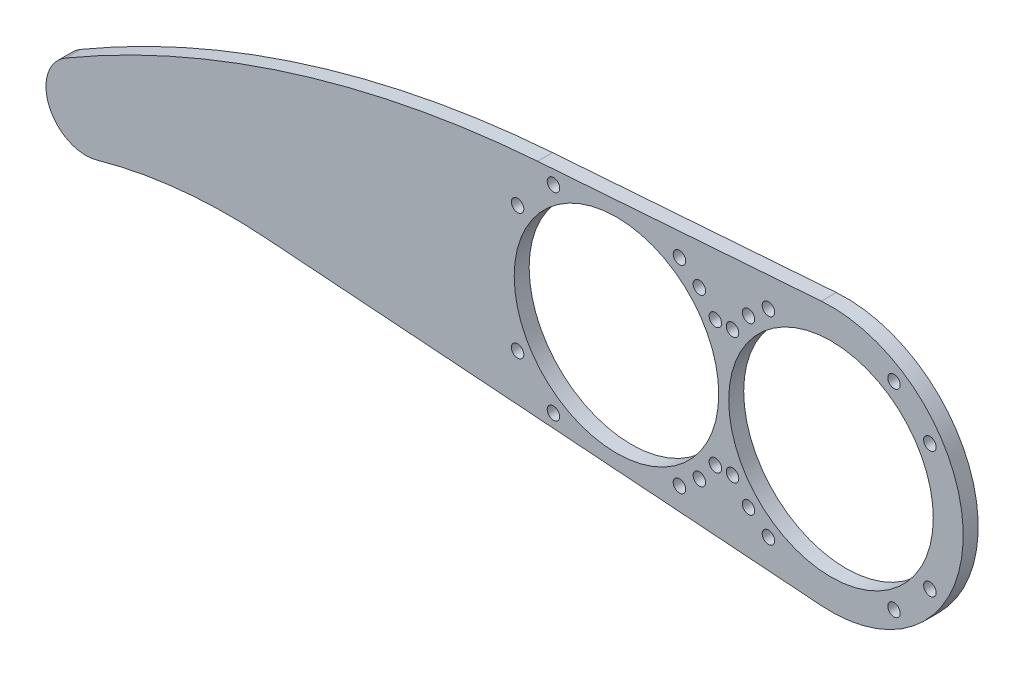
from build123d import *

# Parameters (mm, degrees)
SKETCH_1_R      = 1.25
SKETCH_1_R_2    = 20.5
EXTRUDE_1_DEPTH = 3


with BuildPart() as part:
    # 草图1 → 凸台-拉伸1 (new body)
    with BuildSketch(Plane.XY):
        with BuildLine():
            ThreePointArc((19.526808713, -26.429442292), (47.959314888, 0), (19.526808713, 26.429442292))
            Line((19.526808713, 26.429442292), (-37.358512883, 22.2700191))
            ThreePointArc((-37.358512883, 22.2700191), (-86.32314837, 13.003727731), (-131.924405769, -7.094157925))
            ThreePointArc((-131.924405769, -7.094157925), (-135.248303027, -17.12975341), (-125.715474623, -21.69994513))
            ThreePointArc((-125.715474623, -21.69994513), (-108.970990485, -18.517574939), (-91.928433807, -18.279896723))
            Line((-91.928433807, -18.279896723), (19.526808713, -26.429442292))
        make_face()
        with Locations((-34.167225909, -19.854739779)):
            Circle(SKETCH_1_R, mode=Mode.SUBTRACT)
        with Locations((-8.914144316, -19.854739779)):
            Circle(SKETCH_1_R, mode=Mode.SUBTRACT)
        with Locations((-4.923675755, -16.65205016)):
            Circle(SKETCH_1_R, mode=Mode.SUBTRACT)
        with Locations((8.914144316, -19.854739779)):
            Circle(SKETCH_1_R, mode=Mode.SUBTRACT)
        with Locations((4.923675755, -16.65205016)):
            Circle(SKETCH_1_R, mode=Mode.SUBTRACT)
        with Locations((34.085855684, -19.854739779)):
            Circle(SKETCH_1_R, mode=Mode.SUBTRACT)
        with Locations((-41.360384089, -12.661581598)):
            Circle(SKETCH_1_R, mode=Mode.SUBTRACT)
        with Locations((-1.720986136, -12.661581598)):
            Circle(SKETCH_1_R, mode=Mode.SUBTRACT)
        with Locations((1.720986136, -12.661581598)):
            Circle(SKETCH_1_R, mode=Mode.SUBTRACT)
        with Locations((-21.540685112, 0)):
            Circle(SKETCH_1_R_2, mode=Mode.SUBTRACT)
        with Locations((41.279013864, -12.661581598)):
            Circle(SKETCH_1_R, mode=Mode.SUBTRACT)
        with Locations((-41.360384089, 12.591499994)):
            Circle(SKETCH_1_R, mode=Mode.SUBTRACT)
        with Locations((-1.720986136, 12.591499994)):
            Circle(SKETCH_1_R, mode=Mode.SUBTRACT)
        with Locations((1.720986136, 12.591499994)):
            Circle(SKETCH_1_R, mode=Mode.SUBTRACT)
        with Locations((21.459314888, 0)):
            Circle(SKETCH_1_R_2, mode=Mode.SUBTRACT)
        with Locations((41.279013864, 12.591499994)):
            Circle(SKETCH_1_R, mode=Mode.SUBTRACT)
        with Locations((-34.167225909, 19.784658174)):
            Circle(SKETCH_1_R, mode=Mode.SUBTRACT)
        with Locations((-4.923675755, 16.581968556)):
            Circle(SKETCH_1_R, mode=Mode.SUBTRACT)
        with Locations((-8.914144316, 19.784658174)):
            Circle(SKETCH_1_R, mode=Mode.SUBTRACT)
        with Locations((4.923675755, 16.581968556)):
            Circle(SKETCH_1_R, mode=Mode.SUBTRACT)
        with Locations((8.914144316, 19.784658174)):
            Circle(SKETCH_1_R, mode=Mode.SUBTRACT)
        with Locations((34.085855684, 19.784658174)):
            Circle(SKETCH_1_R, mode=Mode.SUBTRACT)
    extrude(amount=EXTRUDE_1_DEPTH)


solid = part.part
